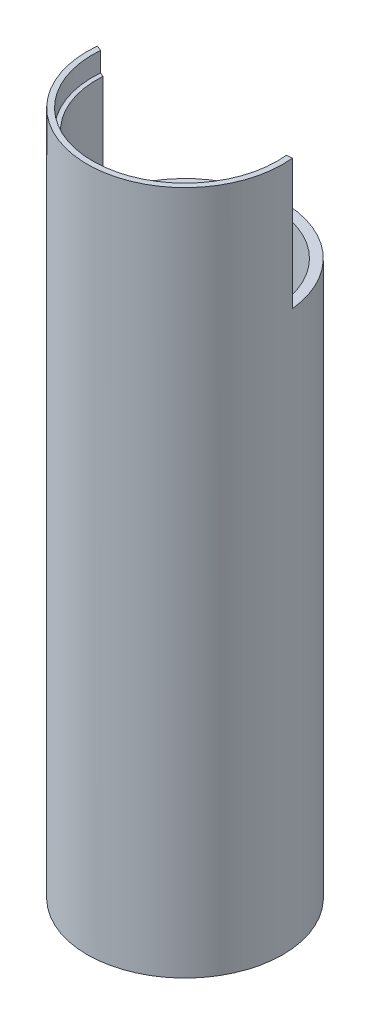
from build123d import *

# Parameters (mm, degrees)
SKETCH1_R           = 15
BOSS_EXTRUDE1_DEPTH = 105
SKETCH6_R           = 14.222015383
CUT_EXTRUDE4_DEPTH  = 3
SHELL1_START        = 3
SHELL1_OUTLINE_R    = 13.5
SHELL1_DEPTH        = 102
SKETCH8_R           = 14.157324042
CUT_EXTRUDE6_DEPTH  = 3
CUT_EXTRUDE7_START  = -20
CUT_EXTRUDE7_DEPTH  = 20


# Read off the part's stored shape, not the designer's step: Shell1
with BuildPart() as part:
    # Sketch1 → Boss-Extrude1 (new body)
    with BuildSketch(Plane(origin=(0, 0, 0), x_dir=(1, 0, 0), z_dir=(0, 1, 0))):
        with Locations(Location((0, 0, 0), (0, 0, 270))):
            Circle(SKETCH1_R)
    extrude(amount=BOSS_EXTRUDE1_DEPTH)

    # Sketch6 → Cut-Extrude4 (cut)
    with BuildSketch(Plane.XZ):
        with Locations(Location((0, 0, 0), (0, 0, 270))):
            Circle(SKETCH6_R)
    extrude(amount=-CUT_EXTRUDE4_DEPTH, mode=Mode.SUBTRACT)

    # Shell1 outline → Shell1 (cut)
    with BuildSketch(Plane(origin=(0, 0, 0), x_dir=(1, 0, 0), z_dir=(0, 1, 0)).offset(SHELL1_START)):
        Circle(SHELL1_OUTLINE_R)
    extrude(amount=SHELL1_DEPTH, mode=Mode.SUBTRACT)

    # Sketch8 → Cut-Extrude6 (cut)
    with BuildSketch(Plane(origin=(0, 105, 0), x_dir=(1, 0, 0), z_dir=(0, 1, 0))):
        with Locations(Location((0, 0, 0), (0, 0, 270))):
            Circle(SKETCH8_R)
    extrude(amount=-CUT_EXTRUDE6_DEPTH, mode=Mode.SUBTRACT)

    # Sketch9 → Cut-Extrude7 (cut)
    with BuildSketch(Plane(origin=(0, 105, 0), x_dir=(1, 0, 0), z_dir=(0, 1, 0)).offset(CUT_EXTRUDE7_START)):
        with BuildLine():
            Line((14.918575787, 1.560799953), (13.426718208, 1.404719958))
            Line((13.426718208, 1.404719958), (-13.47075587, 0.888108258))
            Line((-13.47075587, 0.888108258), (-14.925527409, 1.492860192))
            ThreePointArc((-14.925527409, 1.492860192), (-0.03414724, 14.999961132), (14.918575787, 1.560799953))
        make_face()
    extrude(amount=CUT_EXTRUDE7_DEPTH, mode=Mode.SUBTRACT)


solid = part.part
